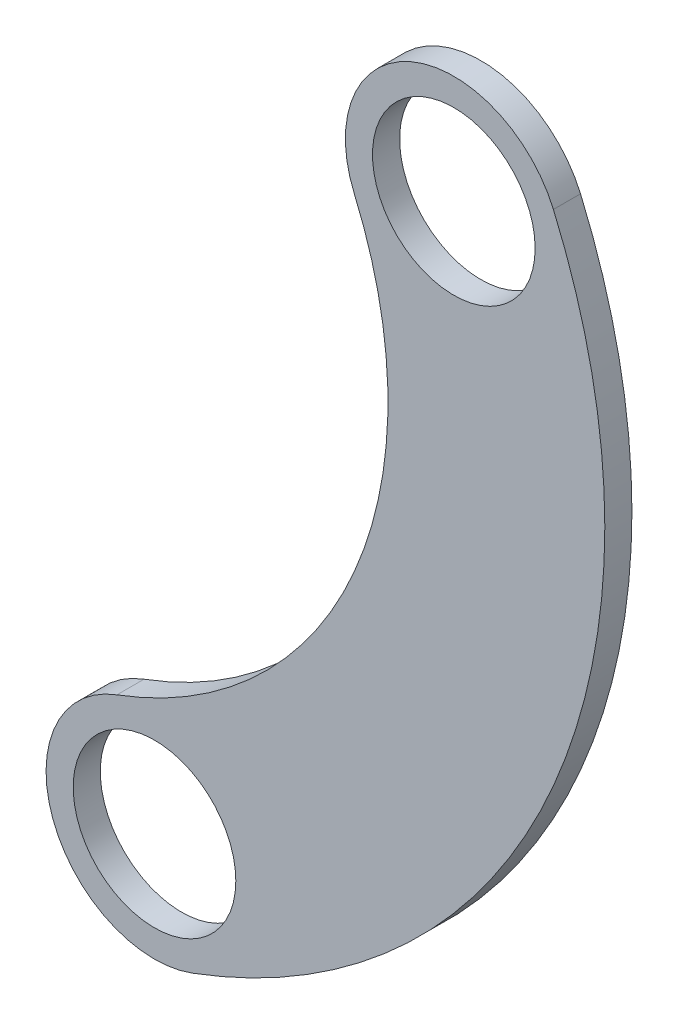
from build123d import *

# Parameters (mm, degrees)
ESQUISSE1_R               = 3
T_LE_DE_BASE_PLI_E1_DEPTH = 1


# Sheet-metal steps are written as plain solids
with BuildPart() as part:
    # Esquisse1 → Tôle de base pliée1 (new body)
    with BuildSketch(Plane.XY):
        with BuildLine():
            ThreePointArc((50.103003121, -34.775696331), (63.4414814, -22.107640128), (63.43362037, -3.712135542))
            ThreePointArc((63.43362037, -3.712135542), (58.178563166, -1.618245911), (56.084673535, -6.873303114))
            ThreePointArc((56.084673535, -6.873303114), (56.089835499, -18.952754623), (47.331092252, -27.271263632))
            ThreePointArc((47.331092252, -27.271263632), (44.964831337, -32.409435416), (50.103003121, -34.775696331))
        make_face()
        with Locations((59.759146953, -5.292719328)):
            Circle(ESQUISSE1_R, mode=Mode.SUBTRACT)
        with Locations((48.717047687, -31.023479981)):
            Circle(ESQUISSE1_R, mode=Mode.SUBTRACT)
    extrude(amount=T_LE_DE_BASE_PLI_E1_DEPTH)


solid = part.part
